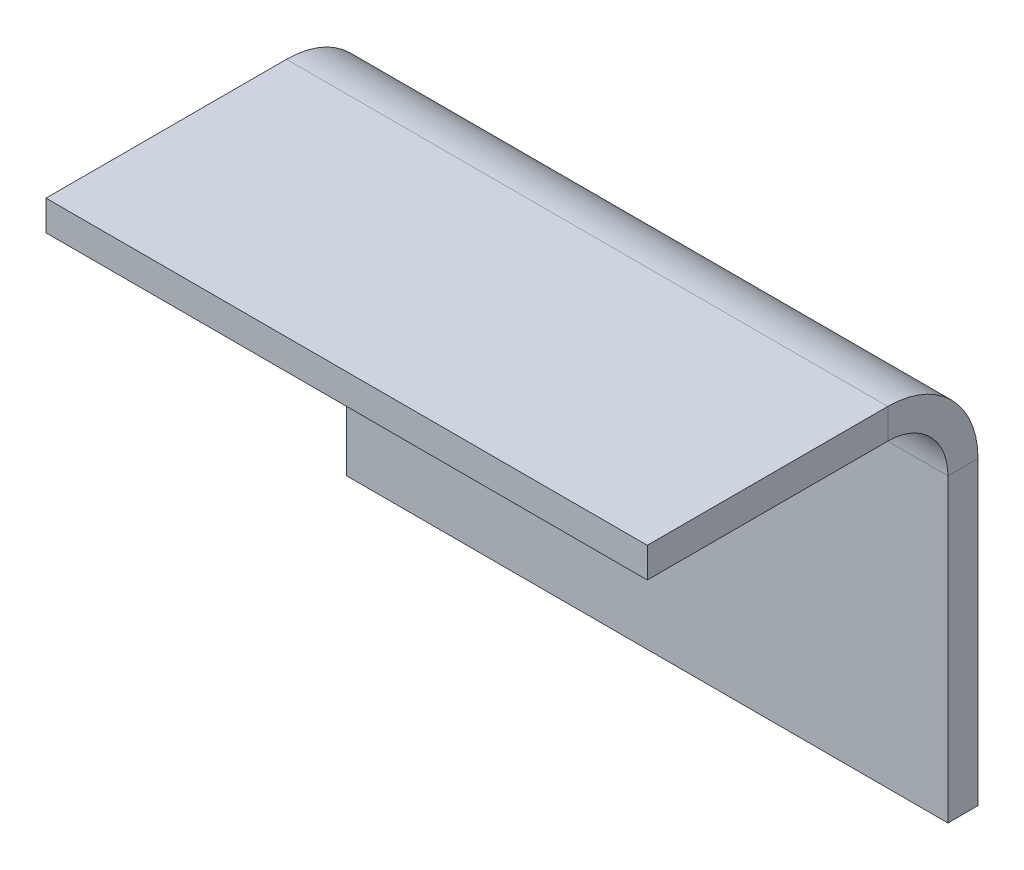
from build123d import *

# Parameters (mm, degrees)
SKETCH_1_W            = 20
SKETCH_1_H            = 10
BASEPLATE_DEPTH       = 1
EDGEFLANGE_DEPTH      = 20
EDGEFLANGE_START      = 1
EDGEFLANGE_FLAT_DEPTH = 1


# Sheet-metal steps are written as plain solids
with BuildPart() as part:
    # Sketch 1 → BasePlate (new body)
    with BuildSketch(Plane.XY):
        with Locations((10, 5)):
            Rectangle(SKETCH_1_W, SKETCH_1_H)
    extrude(amount=-BASEPLATE_DEPTH)

    # EdgeFlange bend section (across the edge) → EdgeFlange (add)
    with BuildSketch(Plane(origin=(20, 12, 0), x_dir=(0, -1, 0), z_dir=(-1, 0, 0))):
        with BuildLine():
            Line((-1, 2), (0, 2))
            ThreePointArc((0, 2), (0.585786438, 0.585786438), (2, 0))
            Line((2, 0), (2, -1))
            ThreePointArc((2, -1), (-0.121320344, -0.121320344), (-1, 2))
        make_face()
    extrude(amount=EDGEFLANGE_DEPTH)

    # EdgeFlange profile (on flange) → EdgeFlange flat (add)
    with BuildSketch(Plane(origin=(0, 12, 0), x_dir=(-1, 0, 0), z_dir=(0, 1, 0)).offset(EDGEFLANGE_START)):
        Polygon((-20, 10), (-20, 2), (0, 2), (0, 10), (-2, 10), (-18, 10), align=None)
    extrude(amount=-EDGEFLANGE_FLAT_DEPTH)


solid = part.part
